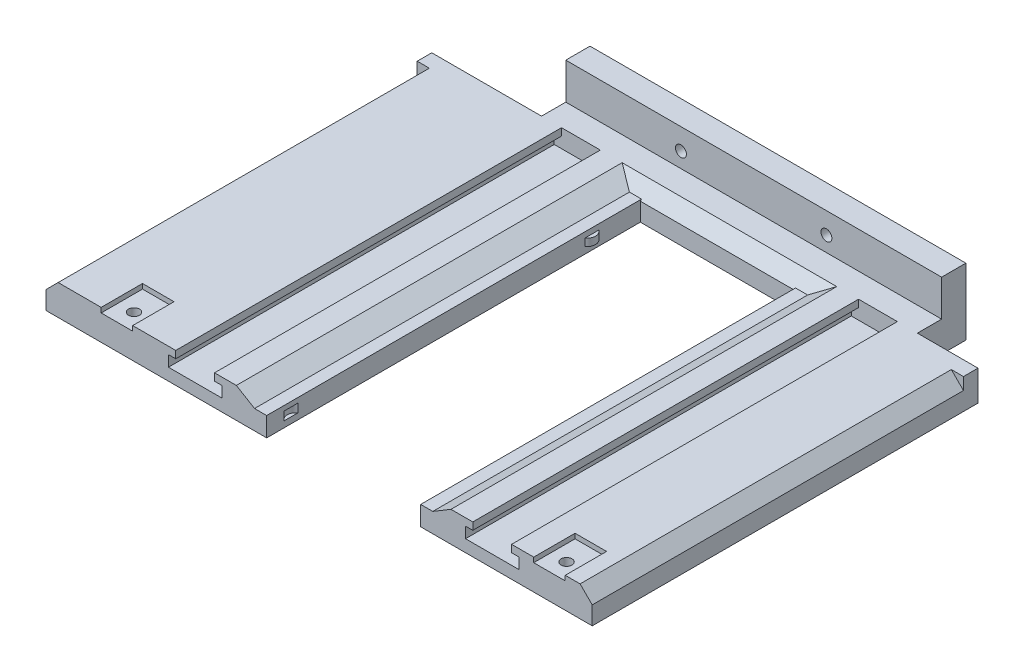
from build123d import *

# Parameters (mm, degrees)
SKETCH1_W            = 225.25
SKETCH1_H            = 12.5
BOSS_EXTRUDE1_DEPTH  = 133.58
CUT_EXTRUDE1_DEPTH   = 159.09
SKETCH11_W           = 88.5
SKETCH11_H           = 154.09
CUT_EXTRUDE2_DEPTH   = 176.169223966
SKETCH12_W           = 13
SKETCH12_H           = 17.045
CUT_EXTRUDE3_DEPTH   = 2
M4_CLEARANCE_HOLE1_D = 4.5
BOSS_EXTRUDE3_DEPTH  = 154.09
CHAMFER4_START       = -19.51
CHAMFER4_DEPTH       = 154.51
CHAMFER5_START       = -19.51
CHAMFER5_DEPTH       = 154.51
CUT_EXTRUDE4_DEPTH   = 1.75
BOSS_EXTRUDE4_DEPTH  = 1.5
CUT_EXTRUDE5_DEPTH   = 176.169223966
CHAMFER6_SIZE        = 5
SKETCH19_W           = 155
SKETCH19_H           = 10
BOSS_EXTRUDE5_DEPTH  = 15
M4_CLEARANCE_HOLE2_D = 4.5


with BuildPart() as part:
    # Sketch1 → Boss-Extrude1 (new, symmetric)
    with BuildSketch(Plane.XY):
        with Locations((0, 6.25)):
            Rectangle(SKETCH1_W, SKETCH1_H)
    extrude(amount=BOSS_EXTRUDE1_DEPTH, both=True)

    # Sketch4 → Cut-Extrude1 (cut)
    with BuildSketch(Plane.XY.offset(133.58)):
        Polygon((-59.125, 12.5), (-59.125, 9.5), (-62.125, 9.5), (-62.125, 5), (-40.125, 5), (-40.125, 9.5), (-43.125, 9.5), (-43.125, 12.5), align=None)
        Polygon((63.375, 12.5), (63.375, 9.5), (60.375, 9.5), (60.375, 5), (82.375, 5), (82.375, 9.5), (79.375, 9.5), (79.375, 12.5), align=None)
    extrude(amount=-CUT_EXTRUDE1_DEPTH, mode=Mode.SUBTRACT)

    # Sketch11 → Cut-Extrude2 (cut, through all)
    with BuildSketch(Plane(origin=(0, 12.5, 0), x_dir=(1, 0, 0), z_dir=(0, 1, 0))):
        with Locations((10.125, -56.535)):
            Rectangle(SKETCH11_W, SKETCH11_H)
    extrude(amount=-CUT_EXTRUDE2_DEPTH, mode=Mode.SUBTRACT)

    # Sketch12 → Cut-Extrude3 (cut)
    with BuildSketch(Plane(origin=(0, 12.5, 0), x_dir=(1, 0, 0), z_dir=(0, 1, 0))):
        with Locations((-83.375, -125.0575)):
            Rectangle(SKETCH12_W, SKETCH12_H)
        with Locations((95, -125.0575)):
            Rectangle(SKETCH12_W, SKETCH12_H)
    extrude(amount=-CUT_EXTRUDE3_DEPTH, mode=Mode.SUBTRACT)

    # M4 Clearance Hole1 (through all)
    with Locations(Plane(origin=(0, 10.5, 0), x_dir=(1, 0, 0), z_dir=(0, 1, 0))):
        with Locations((-83.375, -126.535), (95, -126.535)):
            Hole(M4_CLEARANCE_HOLE1_D / 2)

    # Sketch15 → Boss-Extrude3 (add)
    with BuildSketch(Plane.XY.offset(133.58)):
        Polygon((-34.125, 0), (-21.625, 0), (-21.625, 8), (-26.625, 8), (-34.125, 12.5), align=None)
        Polygon((54.375, 0), (41.875, 0), (41.875, 8), (46.875, 8), (54.375, 12.5), align=None)
    extrude(amount=-BOSS_EXTRUDE3_DEPTH)

    # Chamfer4: read off the stored shape, not the designer's step
    # Chamfer4 outline → Chamfer4 (cut)
    with BuildSketch(Plane.XY.offset(CHAMFER4_START)):
        Polygon((-112.625, 12.5), (-112.625, 7.5), (-107.625, 12.5), align=None)
    extrude(amount=CHAMFER4_DEPTH, mode=Mode.SUBTRACT)

    # Chamfer5: read off the stored shape, not the designer's step
    # Chamfer5 outline → Chamfer5 (cut)
    with BuildSketch(Plane.XY.offset(CHAMFER5_START)):
        Polygon((112.625, 12.5), (107.625, 12.5), (112.625, 7.5), align=None)
    extrude(amount=CHAMFER5_DEPTH, mode=Mode.SUBTRACT)

    # Sketch16 → Cut-Extrude4 (cut, symmetric)
    with BuildSketch(Plane(origin=(0, 4.25, 0), x_dir=(-1, 0, 0), z_dir=(0, -1, 0))):
        with BuildLine():
            Line((21.625, -126.452281323), (21.625, -120.707718677))
            ThreePointArc((21.625, -120.707718677), (23.125, -123.58), (21.625, -126.452281323))
        make_face()
        with BuildLine():
            Line((-41.875, -120.707718677), (-41.875, -126.452281323))
            ThreePointArc((-41.875, -126.452281323), (-43.375, -123.58), (-41.875, -120.707718677))
        make_face()
    extrude(amount=CUT_EXTRUDE4_DEPTH, both=True, mode=Mode.SUBTRACT)

    # Sketch17 → Boss-Extrude4 (add, symmetric)
    with BuildSketch(Plane(origin=(0, 4.25, 0), x_dir=(-1, 0, 0), z_dir=(0, -1, 0))):
        with BuildLine():
            Line((-41.875, 3.382281323), (-41.875, -2.362281323))
            ThreePointArc((-41.875, -2.362281323), (-40.375, 0.51), (-41.875, 3.382281323))
        make_face()
        with BuildLine():
            Line((21.625, -2.362281323), (21.625, 3.382281323))
            ThreePointArc((21.625, 3.382281323), (20.125, 0.51), (21.625, -2.362281323))
        make_face()
    extrude(amount=BOSS_EXTRUDE4_DEPTH, both=True)

    # Sketch18 → Cut-Extrude5 (cut, through all)
    with BuildSketch(Plane(origin=(0, 12.5, 0), x_dir=(1, 0, 0), z_dir=(0, 1, 0))):
        Polygon((87.625, 45.51), (-67.375, 45.51), (-67.375, 25.51), (-112.625, 25.51), (-112.625, 133.58), (112.625, 133.58), (112.625, 25.51), (87.625, 25.51), align=None)
    extrude(amount=-CUT_EXTRUDE5_DEPTH, mode=Mode.SUBTRACT)

    # Chamfer6
    # the kernel refuses this chamfer: 5 mm, written as the material it takes off along each edge
    with BuildSketch(Plane(origin=(67.23341494, 12.5, -20.51), x_dir=(0, -1, 0), z_dir=(-1, 0, 0))) as chamfer6_piece_1_section:
        Polygon((CHAMFER6_SIZE, 0), (0, -CHAMFER6_SIZE), (0, 0), align=None)
    chamfer6_piece_1 = extrude(amount=114.21682988, mode=Mode.PRIVATE)
    chamfer6_piece_1 = split(chamfer6_piece_1, bisect_by=Plane(origin=(41.875, 12.5, -20.51), z_dir=(1, 0, 0)), keep=Keep.TOP, mode=Mode.PRIVATE)
    chamfer6_piece_1 = split(chamfer6_piece_1, bisect_by=Plane(origin=(67.23341494, 8, -20.51), z_dir=(0, 1, 0)), keep=Keep.TOP, mode=Mode.PRIVATE)
    chamfer6_piece_1 = split(chamfer6_piece_1, bisect_by=Plane(origin=(63.829716868, 18.172830121, -20.51), z_dir=(-0.514495755427524, 0.8574929257125457, 0)), keep=Keep.TOP, mode=Mode.PRIVATE)
    add(chamfer6_piece_1, mode=Mode.SUBTRACT)
    with BuildSketch(Plane(origin=(67.23341494, 12.5, -20.51), x_dir=(0, -1, 0), z_dir=(-1, 0, 0))) as chamfer6_piece_2_section:
        Polygon((CHAMFER6_SIZE, 0), (0, -CHAMFER6_SIZE), (0, 0), align=None)
    chamfer6_piece_2 = extrude(amount=114.21682988, mode=Mode.PRIVATE)
    chamfer6_piece_2 = split(chamfer6_piece_2, bisect_by=Plane(origin=(41.875, 12.5, -20.51), z_dir=(-1, 0, 0)), keep=Keep.TOP, mode=Mode.PRIVATE)
    chamfer6_piece_2 = split(chamfer6_piece_2, bisect_by=Plane(origin=(67.23341494, 8, -20.51), z_dir=(0, -1, 0)), keep=Keep.TOP, mode=Mode.PRIVATE)
    chamfer6_piece_2 = split(chamfer6_piece_2, bisect_by=Plane(origin=(-21.625, 12.5, -20.51), z_dir=(1, 0, 0)), keep=Keep.TOP, mode=Mode.PRIVATE)
    add(chamfer6_piece_2, mode=Mode.SUBTRACT)
    with BuildSketch(Plane(origin=(67.23341494, 12.5, -20.51), x_dir=(0, -1, 0), z_dir=(-1, 0, 0))) as chamfer6_piece_3_section:
        Polygon((CHAMFER6_SIZE, 0), (0, -CHAMFER6_SIZE), (0, 0), align=None)
    chamfer6_piece_3 = extrude(amount=114.21682988, mode=Mode.PRIVATE)
    chamfer6_piece_3 = split(chamfer6_piece_3, bisect_by=Plane(origin=(41.875, 12.5, -20.51), z_dir=(-1, 0, 0)), keep=Keep.TOP, mode=Mode.PRIVATE)
    chamfer6_piece_3 = split(chamfer6_piece_3, bisect_by=Plane(origin=(67.23341494, 8, -20.51), z_dir=(0, 1, 0)), keep=Keep.TOP, mode=Mode.PRIVATE)
    chamfer6_piece_3 = split(chamfer6_piece_3, bisect_by=Plane(origin=(-21.625, 12.5, -20.51), z_dir=(1, 0, 0)), keep=Keep.TOP, mode=Mode.PRIVATE)
    add(chamfer6_piece_3, mode=Mode.SUBTRACT)
    with BuildSketch(Plane(origin=(67.23341494, 12.5, -20.51), x_dir=(0, -1, 0), z_dir=(-1, 0, 0))) as chamfer6_piece_4_section:
        Polygon((CHAMFER6_SIZE, 0), (0, -CHAMFER6_SIZE), (0, 0), align=None)
    chamfer6_piece_4 = extrude(amount=114.21682988, mode=Mode.PRIVATE)
    chamfer6_piece_4 = split(chamfer6_piece_4, bisect_by=Plane(origin=(40.403246279, -32.216947768, -20.51), z_dir=(0.5144957554275245, 0.8574929257125454, 0)), keep=Keep.TOP, mode=Mode.PRIVATE)
    chamfer6_piece_4 = split(chamfer6_piece_4, bisect_by=Plane(origin=(67.23341494, 8, -20.51), z_dir=(0, 1, 0)), keep=Keep.TOP, mode=Mode.PRIVATE)
    chamfer6_piece_4 = split(chamfer6_piece_4, bisect_by=Plane(origin=(-21.625, 12.5, -20.51), z_dir=(-1, 0, 0)), keep=Keep.TOP, mode=Mode.PRIVATE)
    add(chamfer6_piece_4, mode=Mode.SUBTRACT)

    # Sketch19 → Boss-Extrude5 (add)
    with BuildSketch(Plane(origin=(0, 12.5, 0), x_dir=(1, 0, 0), z_dir=(0, 1, 0))):
        with Locations((10.125, 40.51)):
            Rectangle(SKETCH19_W, SKETCH19_H)
    extrude(amount=BOSS_EXTRUDE5_DEPTH)

    # M4 Clearance Hole2 (through all)
    with Locations(Plane.XY.offset(-35.51)):
        with Locations((-19.875, 18.75), (40.125, 18.75)):
            Hole(M4_CLEARANCE_HOLE2_D / 2)


solid = part.part
